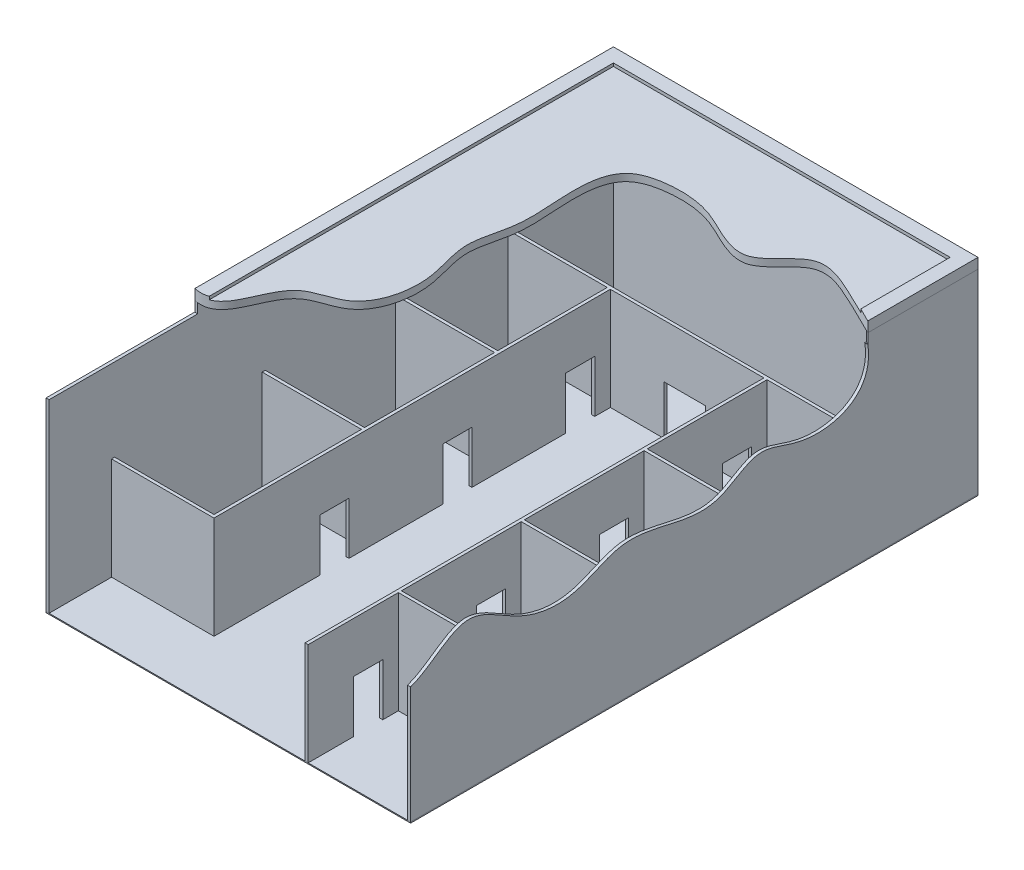
from build123d import *

# Parameters (mm, degrees)
EXTRUDE_THIN2_DEPTH         = 10000
EXTRUDE_THIN2_2_OUTLINE_W   = 10000
EXTRUDE_THIN2_2_OUTLINE_H   = 300
EXTRUDE_THIN2_2_DEPTH       = 10000
EXTRUDE_THIN2_3_OUTLINE_W   = 10000
EXTRUDE_THIN2_3_OUTLINE_H   = 300
EXTRUDE_THIN2_3_DEPTH       = 10000
EXTRUDE_THIN2_4_OUTLINE_W   = 10000
EXTRUDE_THIN2_4_OUTLINE_H   = 300
EXTRUDE_THIN2_4_DEPTH       = 10000
EXTRUDE_THIN2_5_OUTLINE_W   = 10000
EXTRUDE_THIN2_5_OUTLINE_H   = 300
EXTRUDE_THIN2_5_DEPTH       = 10000
EXTRUDE_THIN2_6_OUTLINE_W   = 35600
EXTRUDE_THIN2_6_OUTLINE_H   = 56600
EXTRUDE_THIN2_6_OUTLINE_W_2 = 35000
EXTRUDE_THIN2_6_OUTLINE_H_2 = 56000
EXTRUDE_THIN2_6_DEPTH       = 10000
EXTRUDE_THIN2_7_DEPTH       = 10000
EXTRUDE_THIN2_8_OUTLINE_W   = 10000
EXTRUDE_THIN2_8_OUTLINE_H   = 300
EXTRUDE_THIN2_8_DEPTH       = 10000
SKETCH2_W                   = 2840.487195872
SKETCH2_H                   = 5086.44587618
CUT_EXTRUDE1_DEPTH          = 300
SKETCH3_W                   = 2840.487195872
SKETCH3_H                   = 5086.44587618
CUT_EXTRUDE4_DEPTH          = 300
LPATTERN1_COUNT             = 4
LPATTERN1_PITCH             = 12000
CUT_EXTRUDE5_REACH          = 60171.76
SKETCH4_W                   = 4021.279474752
SKETCH4_H                   = 4790.784908198
LPATTERN2_COUNT             = 3
LPATTERN2_PITCH             = 12000
SKETCH6_W                   = 15600
SKETCH6_H                   = 300
BOSS_EXTRUDE1_DEPTH         = 10000
CUT_EXTRUDE7_REACH          = 50329.329
SKETCH5_W                   = 4021.279474752
SKETCH5_H                   = 4790.784908198
SKETCH7_W                   = 35600
SKETCH7_H                   = 56600
SKETCH7_W_2                 = 35000
SKETCH7_H_2                 = 56000
BOSS_EXTRUDE2_DEPTH         = 9047
SKETCH8_W                   = 35600
SKETCH8_H                   = 56600
BOSS_EXTRUDE3_DEPTH         = 1000
SKETCH9_W                   = 32880
SKETCH9_H                   = 53880
CUT_EXTRUDE9_DEPTH          = 300
BOSS_EXTRUDE4_DEPTH         = 100
CUT_EXTRUDE12_DEPTH         = 1989
CUT_EXTRUDE13_DEPTH         = 1989
SKETCH16_W                  = 41966.6485265
SKETCH16_H                  = 4716.251929645
CUT_EXTRUDE14_DEPTH         = 38046.275186404


with BuildPart() as part:
    # Extrude-Thin2: read off the stored shape, not the designer's step
    # Extrude-Thin2 outline → Extrude-Thin2 (new body)
    with BuildSketch(Plane(origin=(0, 0, 0), x_dir=(1, 0, 0), z_dir=(0, 1, 0))):
        Polygon((7800, 17700), (17500, 17700), (17500, 18000), (7500, 18000), (7500, -28000), (7800, -28000), align=None)
    extrude(amount=EXTRUDE_THIN2_DEPTH)

    # Sketch2 → Cut-Extrude1 (cut)
    with BuildSketch(Plane(origin=(7800, 0, 0), x_dir=(0, 0, -1), z_dir=(1, 0, 0))):
        with Locations((14763.291743807, 2543.22293809)):
            Rectangle(SKETCH2_W, SKETCH2_H)
    cut_extrude1 = extrude(amount=-CUT_EXTRUDE1_DEPTH, mode=Mode.SUBTRACT)

    # LPattern1: Cut-Extrude1 ×4
    with Locations(*[(0, 0, i * LPATTERN1_PITCH) for i in range(1, LPATTERN1_COUNT)]):
        add(cut_extrude1, mode=Mode.SUBTRACT)


with BuildPart() as body_2:
    # Extrude-Thin2 2 outline → Extrude-Thin2 2 (new body)
    with BuildSketch(Plane(origin=(0, 0, 0), x_dir=(1, 0, 0), z_dir=(0, 1, 0))):
        with Locations((12500, 5850)):
            Rectangle(EXTRUDE_THIN2_2_OUTLINE_W, EXTRUDE_THIN2_2_OUTLINE_H)
    extrude(amount=EXTRUDE_THIN2_2_DEPTH)


with BuildPart() as body_3:
    # Extrude-Thin2 3 outline → Extrude-Thin2 3 (new body)
    with BuildSketch(Plane(origin=(0, 0, 0), x_dir=(1, 0, 0), z_dir=(0, 1, 0))):
        with Locations((-12500, -6150)):
            Rectangle(EXTRUDE_THIN2_3_OUTLINE_W, EXTRUDE_THIN2_3_OUTLINE_H)
    extrude(amount=EXTRUDE_THIN2_3_DEPTH)


with BuildPart() as body_4:
    # Extrude-Thin2 4 outline → Extrude-Thin2 4 (new body)
    with BuildSketch(Plane(origin=(0, 0, 0), x_dir=(1, 0, 0), z_dir=(0, 1, 0))):
        with Locations((12500, -6150)):
            Rectangle(EXTRUDE_THIN2_4_OUTLINE_W, EXTRUDE_THIN2_4_OUTLINE_H)
    extrude(amount=EXTRUDE_THIN2_4_DEPTH)


with BuildPart() as body_5:
    # Extrude-Thin2 5 outline → Extrude-Thin2 5 (new body)
    with BuildSketch(Plane(origin=(0, 0, 0), x_dir=(1, 0, 0), z_dir=(0, 1, 0))):
        with Locations((12500, -18150)):
            Rectangle(EXTRUDE_THIN2_5_OUTLINE_W, EXTRUDE_THIN2_5_OUTLINE_H)
    extrude(amount=EXTRUDE_THIN2_5_DEPTH)


with BuildPart() as body_6:
    # Extrude-Thin2 6 outline → Extrude-Thin2 6 (new body)
    with BuildSketch(Plane(origin=(0, 0, 0), x_dir=(1, 0, 0), z_dir=(0, 1, 0))):
        Rectangle(EXTRUDE_THIN2_6_OUTLINE_W, EXTRUDE_THIN2_6_OUTLINE_H)
        Rectangle(EXTRUDE_THIN2_6_OUTLINE_W_2, EXTRUDE_THIN2_6_OUTLINE_H_2, mode=Mode.SUBTRACT)
    extrude(amount=EXTRUDE_THIN2_6_DEPTH)


with BuildPart() as body_7:
    # Extrude-Thin2 7 outline → Extrude-Thin2 7 (new body)
    with BuildSketch(Plane(origin=(0, 0, 0), x_dir=(1, 0, 0), z_dir=(0, 1, 0))):
        Polygon((-7800, -20700), (-17500, -20700), (-17500, -21000), (-7500, -21000), (-7500, 18000), (-17500, 18000), (-17500, 17700), (-7800, 17700), align=None)
    extrude(amount=EXTRUDE_THIN2_7_DEPTH)

    # Sketch3 → Cut-Extrude4 (cut)
    with BuildSketch(Plane.ZY.offset(7800)):
        with Locations((-14763.291743807, 2543.22293809)):
            Rectangle(SKETCH3_W, SKETCH3_H)
    cut_extrude4 = extrude(amount=-CUT_EXTRUDE4_DEPTH, mode=Mode.SUBTRACT)


with BuildPart() as body_8:
    # Extrude-Thin2 8 outline → Extrude-Thin2 8 (new body)
    with BuildSketch(Plane(origin=(0, 0, 0), x_dir=(1, 0, 0), z_dir=(0, 1, 0))):
        with Locations((-12500, 6850)):
            Rectangle(EXTRUDE_THIN2_8_OUTLINE_W, EXTRUDE_THIN2_8_OUTLINE_H)
    extrude(amount=EXTRUDE_THIN2_8_DEPTH)


with BuildPart() as body_6_1:
    add(body_6.part)

    # Combine1: read off the stored shape, not the designer's step
    # Combine1: union part, body 2, body 3, body 4, body 5, body 7, body 8
    add(part.part)
    add(body_2.part)
    add(body_3.part)
    add(body_4.part)
    add(body_5.part)
    add(body_7.part)
    add(body_8.part)

    # Sketch4 → Cut-Extrude5 (cut, up to next)
    with BuildSketch(Plane.XY.offset(28300), mode=Mode.PRIVATE) as cut_extrude5_sk1:
        with Locations((-237.626268566, 2395.392454099)):
            Rectangle(SKETCH4_W, SKETCH4_H)
    cut_extrude5_tool1 = extrude(cut_extrude5_sk1.sketch, amount=-CUT_EXTRUDE5_REACH, mode=Mode.PRIVATE) & body_6_1.part
    add(cut_extrude5_tool1.solids().sort_by_distance((-237.626269, 2395.392454, 28300))[0], mode=Mode.SUBTRACT)

    # LPattern2: Cut-Extrude4 ×3
    with Locations(*[(0, 0, i * LPATTERN2_PITCH) for i in range(1, LPATTERN2_COUNT)]):
        add(cut_extrude4, mode=Mode.SUBTRACT)

    # Sketch6 → Boss-Extrude1 (add, through all)
    with BuildSketch(Plane(origin=(0, 10000, 0), x_dir=(1, 0, 0), z_dir=(0, 1, 0))):
        with Locations((0, 17850)):
            Rectangle(SKETCH6_W, SKETCH6_H)
    extrude(amount=-BOSS_EXTRUDE1_DEPTH)

    # Sketch5 → Cut-Extrude7 (cut, up to next)
    with BuildSketch(Plane.XY.offset(-17700), mode=Mode.PRIVATE) as cut_extrude7_sk1:
        with Locations((-237.626268566, 2395.392454099)):
            Rectangle(SKETCH5_W, SKETCH5_H)
    cut_extrude7_tool1 = extrude(cut_extrude7_sk1.sketch, amount=-CUT_EXTRUDE7_REACH, mode=Mode.PRIVATE) & body_6_1.part
    add(cut_extrude7_tool1.solids().sort_by_distance((-237.626269, 2395.392454, -17700))[0], mode=Mode.SUBTRACT)

    # Sketch7 → Boss-Extrude2 (add)
    with BuildSketch(Plane(origin=(0, 10000, 0), x_dir=(1, 0, 0), z_dir=(0, 1, 0))):
        Rectangle(SKETCH7_W, SKETCH7_H)
        Rectangle(SKETCH7_W_2, SKETCH7_H_2, mode=Mode.SUBTRACT)
    extrude(amount=BOSS_EXTRUDE2_DEPTH)


with BuildPart() as body_2_2:
    # Sketch8 → Boss-Extrude3 (new body)
    with BuildSketch(Plane(origin=(0, 19047, 0), x_dir=(1, 0, 0), z_dir=(0, 1, 0))):
        Rectangle(SKETCH8_W, SKETCH8_H)
    extrude(amount=BOSS_EXTRUDE3_DEPTH)

    # Sketch9 → Cut-Extrude9 (cut)
    with BuildSketch(Plane(origin=(0, 20047, 0), x_dir=(1, 0, 0), z_dir=(0, 1, 0))):
        Rectangle(SKETCH9_W, SKETCH9_H)
    extrude(amount=-CUT_EXTRUDE9_DEPTH, mode=Mode.SUBTRACT)


with BuildPart() as body_3_2:
    # Sketch10 → Boss-Extrude4 (new body)
    with BuildSketch(Plane.XZ):
        Polygon((-2248.266005942, 28300), (1773.01346881, 28300), (17800, 28300), (17800, -28300), (-17800, -28300), (-17800, 28300), align=None)
    extrude(amount=BOSS_EXTRUDE4_DEPTH)


with BuildPart() as cut_extrude12_tool:
    # Sketch14 → Cut-Extrude12 (new body)
    with BuildSketch(Plane(origin=(0, 20047, 0), x_dir=(1, 0, 0), z_dir=(0, 1, 0))):
        with BuildLine():
            Line((-21384.712871287, -10625.108910891), (-21384.712871287, -34027.247524752))
            Line((-21384.712871287, -34027.247524752), (22640, -34027.247524752))
            Line((22640, -34027.247524752), (22640, 15108.277227723))
            add(Edge.make_bspline(
                [(-21384.712871287, -10625.108910891), (-14311.396231758, -15927.042242074), (-15808.445269562, -7142.562265962), (-8260.824631032, -6154.957820679), (-6883.478396996, -161.499897077), (-9055.560514001, 4377.398062077), (-7502.711096778, 8776.218877837), (-7927.340114078, 13184.156007349), (-8004.315237241, 18801.487228366), (-3182.460853085, 19905.245036641), (565.751788491, 19508.461317148), (3376.664962695, 17727.258434054), (7063.350759334, 16950.102049177), (9244.82485882, 21492.353990454), (16018.673140004, 18561.982378565), (19493.258670988, 16629.61528341), (22640, 15108.277227723)],
                knots=[0, 0, 0, 0, 0.147075102, 0.196122792, 0.283361135, 0.352700935, 0.404934815, 0.468423115, 0.550695527, 0.594305773, 0.656256307, 0.708220595, 0.735492104, 0.803336315, 0.860182056, 1, 1, 1, 1], degree=3))
        make_face()
    extrude(amount=-CUT_EXTRUDE12_DEPTH)


with BuildPart() as body_6_2:
    add(body_6_1.part)

    # Cut-Extrude12: cut by cut_extrude12_tool
    add(cut_extrude12_tool.part, mode=Mode.SUBTRACT)

    # Sketch15 → Cut-Extrude13 (cut)
    with BuildSketch(Plane(origin=(17800, 0, 0), x_dir=(0, 0, -1), z_dir=(1, 0, 0))):
        with BuildLine():
            Line((17538.935339039, 18058), (15554.317408935, 30731.389549032))
            Line((15554.317408935, 30731.389549032), (-34011.115133042, 30731.389549032))
            Line((-34011.115133042, 30731.389549032), (-34011.115133042, 13024.398913107))
            Line((-34011.115133042, 13024.398913107), (-30227.023509272, 11905.787864192))
            add(Edge.make_bspline(
                [(17538.935339039, 18058), (17830.171315265, 16198.22290063), (16443.872497943, 13127.178232494), (11053.20722859, 12608.034192157), (6680.361427215, 14972.321608914), (2831.550503075, 11415.480438721), (-1955.969337226, 12596.847188558), (-6803.124306669, 13609.848849487), (-11206.42879455, 10745.870517688), (-16685.06009653, 11563.534475845), (-22774.307279571, 16760.242514635), (-26933.796683134, 9542.972040562), (-30227.023509272, 11905.787864192)],
                knots=[0, 0, 0, 0, 0.080199324, 0.18892076, 0.262137223, 0.340956831, 0.443244309, 0.52711899, 0.616017564, 0.722903134, 0.829218447, 1, 1, 1, 1], degree=3))
        make_face()
    extrude(amount=-CUT_EXTRUDE13_DEPTH, mode=Mode.SUBTRACT)


with BuildPart() as body_2_2_1:
    add(body_2_2.part)

    # Cut-Extrude12: cut by cut_extrude12_tool
    add(cut_extrude12_tool.part, mode=Mode.SUBTRACT)


with BuildPart() as cut_extrude14_tool:
    # Sketch16 → Cut-Extrude14 (new, through all)
    with BuildSketch(Plane(origin=(0, 18058, 0), x_dir=(1, 0, 0), z_dir=(0, 1, 0))):
        with Locations((834.99645456, -29460.401899779)):
            Rectangle(SKETCH16_W, SKETCH16_H)
    extrude(amount=-CUT_EXTRUDE14_DEPTH)


with BuildPart() as body_6_3:
    add(body_6_2.part)

    # Cut-Extrude14: cut by cut_extrude14_tool
    add(cut_extrude14_tool.part, mode=Mode.SUBTRACT)


with BuildPart() as body_3_2_1:
    add(body_3_2.part)

    # Cut-Extrude14: cut by cut_extrude14_tool
    add(cut_extrude14_tool.part, mode=Mode.SUBTRACT)


solid = Compound([body_2_2_1.part, body_6_3.part, body_3_2_1.part])
